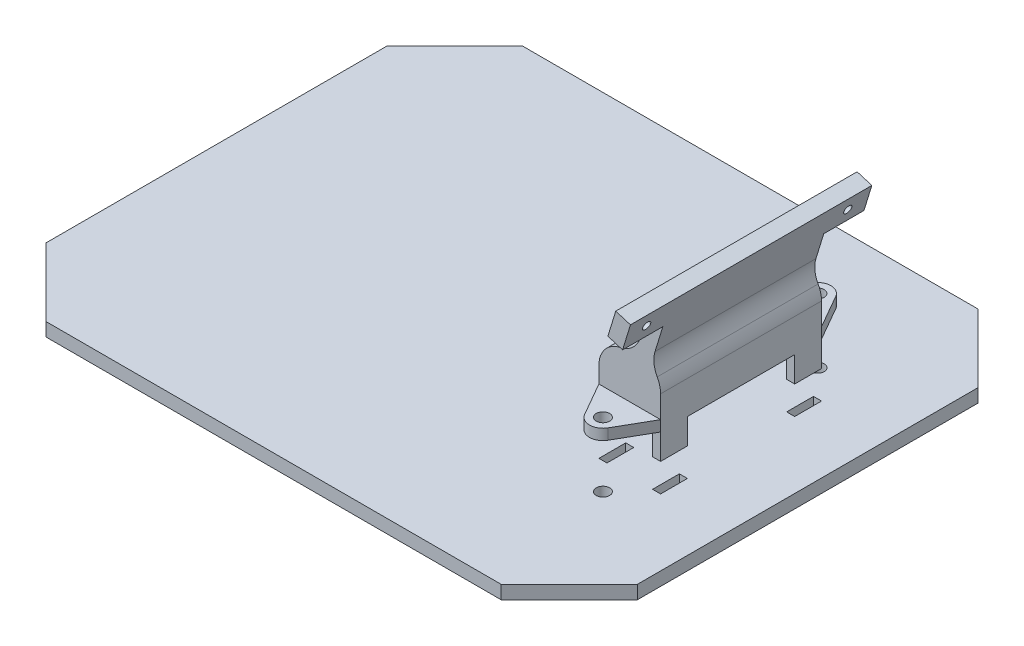
from build123d import *

# Parameters (mm, degrees)
SKETCH2_W               = 190.5
SKETCH2_H               = 177.8
BOSS_EXTRUDE1_DEPTH     = 5.08
CHAMFER1_SIZE           = 25.4
BOSS_EXTRUDE3_DEPTH     = 68.42
SKETCH5_R               = 9
SKETCH5_R_2             = 1.5
CUT_EXTRUDE1_DEPTH      = 231.530019737
SKETCH10_W              = 177.8
SKETCH10_H              = 73.5
BOSS_EXTRUDE6_DEPTH     = 30
CHAMFER3_SIZE           = 25.4
CUT_EXTRUDE2_DEPTH      = 68.42
BOSS_EXTRUDE7_START     = 38.1
BOSS_EXTRUDE7_DEPTH     = 10
SKETCH13_W              = 15.24
SKETCH13_H              = 10
BOSS_EXTRUDE8_DEPTH     = 7
SKETCH14_R              = 2.5
CUT_EXTRUDE3_DEPTH      = 10
MIRROR4_COPY_1_SKETCH_W = 15.24
MIRROR4_COPY_1_SKETCH_H = 10
MIRROR4_COPY_1_DEPTH    = 7
MIRROR4_COPY_2_SKETCH_R = 2.5
MIRROR4_COPY_2_DEPTH    = 10
BOSS_EXTRUDE9_START     = 5
BOSS_EXTRUDE9_DEPTH     = 5
BOSS_EXTRUDE10_START    = 10
BOSS_EXTRUDE10_DEPTH    = 5
SKETCH16_R              = 2.5
CUT_EXTRUDE4_DEPTH      = 163.946494286
SKETCH17_W              = 3
SKETCH17_H              = 10
CUT_EXTRUDE5_DEPTH      = 163.946494286
BOSS_EXTRUDE11_START    = 10
SKETCH18_W              = 3
SKETCH18_H              = 10
BOSS_EXTRUDE11_DEPTH    = 10
BOSS_EXTRUDE11_2_DEPTH  = 10
BOSS_EXTRUDE11_3_DEPTH  = 10
BOSS_EXTRUDE11_4_DEPTH  = 10
SKETCH19_W              = 23
SKETCH19_H              = 60
BOSS_EXTRUDE12_DEPTH    = 20
BOSS_EXTRUDE13_START    = -20
SKETCH20_R              = 2.5
BOSS_EXTRUDE13_DEPTH    = 4
BOSS_EXTRUDE16_DEPTH    = 60
FILLET1_R               = 10
SKETCH24_W              = 90
SKETCH24_H              = 10
BOSS_EXTRUDE17_DEPTH    = 5.736414059
SKETCH25_R              = 1.5
CUT_EXTRUDE7_DEPTH      = 10
FILLET2_R               = 10
FILLET3_R               = 10
FILLET4_R               = 10
CHAMFER4_SIZE           = 0.5


with BuildPart() as part:
    # Sketch2 → Boss-Extrude1 (new body)
    with BuildSketch(Plane(origin=(0, 0, 0), x_dir=(1, 0, 0), z_dir=(0, 1, 0))):
        with Locations((-31.75, -12.7)):
            Rectangle(SKETCH2_W, SKETCH2_H)
    extrude(amount=BOSS_EXTRUDE1_DEPTH)

    # Chamfer1
    chamfer1_edges = [part.edges().sort_by_distance(p)[0] for p in [
        (-127, 2.54, -76.2),
        (-127, 2.54, 101.6),
    ]]
    chamfer(chamfer1_edges, length=CHAMFER1_SIZE)

    # Sketch4 → Boss-Extrude3 (add)
    with BuildSketch(Plane(origin=(0, 5.08, 0), x_dir=(1, 0, 0), z_dir=(0, 1, 0))):
        Polygon((57.15, 69.85), (-98.969743879, 69.85), (-120.65, 48.169743879), (-120.65, -73.569743879), (-98.969743879, -95.25), (57.15, -95.25), (63.5, -95.25), (63.5, -101.6), (-101.6, -101.6), (-127, -76.2), (-127, 50.8), (-101.6, 76.2), (63.5, 76.2), (63.5, 69.85), align=None)
    extrude(amount=BOSS_EXTRUDE3_DEPTH)

    # Sketch5 → Cut-Extrude1 (cut, through all)
    with BuildSketch(Plane.XY.offset(101.6)):
        with Locations((-50.8, 31.75)):
            Circle(SKETCH5_R)
        with Locations((-50.8, 47.25)):
            Circle(SKETCH5_R_2)
        with Locations((-37.376606241, 39.5)):
            Circle(SKETCH5_R_2)
        with Locations((-37.376606241, 24)):
            Circle(SKETCH5_R_2)
        with Locations((-50.8, 16.25)):
            Circle(SKETCH5_R_2)
        with Locations((-64.223393759, 24)):
            Circle(SKETCH5_R_2)
        with Locations((-64.223393759, 39.5)):
            Circle(SKETCH5_R_2)
    extrude(amount=-CUT_EXTRUDE1_DEPTH, mode=Mode.SUBTRACT)

    # Sketch10 → Boss-Extrude6 (add)
    with BuildSketch(Plane(origin=(63.5, 0, 0), x_dir=(0, 0, -1), z_dir=(1, 0, 0))):
        with Locations((-12.7, 36.75)):
            Rectangle(SKETCH10_W, SKETCH10_H)
    extrude(amount=BOSS_EXTRUDE6_DEPTH)

    # Chamfer3
    chamfer3_edges = [part.edges().sort_by_distance(p)[0] for p in [
        (93.5, 36.75, 101.6),
        (93.5, 36.75, -76.2),
    ]]
    chamfer(chamfer3_edges, length=CHAMFER3_SIZE)

    # Sketch11 → Cut-Extrude2 (cut)
    with BuildSketch(Plane(origin=(0, 73.5, 0), x_dir=(1, 0, 0), z_dir=(0, 1, 0))):
        Polygon((85.757180746, -72.992819254), (85.757180746, 47.592819254), (63.5, 69.85), (63.5, -95.25), align=None)
    extrude(amount=-CUT_EXTRUDE2_DEPTH, mode=Mode.SUBTRACT)

    # Sketch12 → Boss-Extrude7 (add)
    with BuildSketch(Plane(origin=(0, 0, 95.25), x_dir=(-1, 0, 0), z_dir=(0, 0, -1)).offset(BOSS_EXTRUDE7_START)):
        with BuildLine():
            Line((25.8, 5.08), (75.8, 5.08))
            Line((75.8, 5.08), (75.8, 31.75))
            Line((75.8, 31.75), (69.8, 31.75))
            ThreePointArc((69.8, 31.75), (50.8, 12.75), (31.8, 31.75))
            Line((31.8, 31.75), (25.8, 31.75))
            Line((25.8, 31.75), (25.8, 5.08))
        make_face()
    boss_extrude7 = extrude(amount=BOSS_EXTRUDE7_DEPTH)

    # Sketch13 → Boss-Extrude8 (add)
    with BuildSketch(Plane(origin=(0, 31.75, 0), x_dir=(1, 0, 0), z_dir=(0, 1, 0))):
        with Locations((-24.18, -52.15)):
            Rectangle(SKETCH13_W, SKETCH13_H)
    boss_extrude8 = extrude(amount=-BOSS_EXTRUDE8_DEPTH)

    # Sketch14 → Cut-Extrude3 (cut)
    with BuildSketch(Plane(origin=(0, 31.75, 0), x_dir=(1, 0, 0), z_dir=(0, 1, 0))):
        with Locations(Location((-20.37, -52.15, 0), (0, 0, 270))):
            Circle(SKETCH14_R)
    cut_extrude3 = extrude(amount=-CUT_EXTRUDE3_DEPTH, mode=Mode.SUBTRACT)

    # Mirror2: Boss-Extrude8 across plane
    add(boss_extrude8.mirror(Plane.ZY.offset(50.8)))

    # Mirror3: Cut-Extrude3 across plane
    add(cut_extrude3.mirror(Plane.ZY.offset(50.8)), mode=Mode.SUBTRACT)

    # Mirror4: Boss-Extrude7, Boss-Extrude8, Cut-Extrude3 across plane
    add(boss_extrude7.mirror(Plane.XY.offset(12.7)))
    add(boss_extrude8.mirror(Plane.XY.offset(12.7)))
    add(cut_extrude3.mirror(Plane.XY.offset(12.7)), mode=Mode.SUBTRACT)

    # Mirror4 copy 1 sketch → Mirror4 copy 1 (add)
    with BuildSketch(Plane(origin=(-101.6, 31.75, 25.4), x_dir=(-1, 0, 0), z_dir=(0, 1, 0))):
        with Locations((-24.18, -52.15)):
            Rectangle(MIRROR4_COPY_1_SKETCH_W, MIRROR4_COPY_1_SKETCH_H)
    extrude(amount=-MIRROR4_COPY_1_DEPTH)

    # Mirror4 copy 2 sketch → Mirror4 copy 2 (cut)
    with BuildSketch(Plane(origin=(-101.6, 31.75, 25.4), x_dir=(-1, 0, 0), z_dir=(0, 1, 0))):
        with Locations(Location((-20.37, -52.15, 0), (0, 0, 270))):
            Circle(MIRROR4_COPY_2_SKETCH_R)
    extrude(amount=-MIRROR4_COPY_2_DEPTH, mode=Mode.SUBTRACT)


with BuildPart() as body_2:
    # Sketch15 → Boss-Extrude9 (new body)
    with BuildSketch(Plane(origin=(0, 73.5, 0), x_dir=(1, 0, 0), z_dir=(0, 1, 0)).offset(BOSS_EXTRUDE9_START)):
        Polygon((85.757180746, 47.592819254), (63.5, 69.85), (-98.969743879, 69.85), (-120.65, 48.169743879), (-120.65, -73.569743879), (-98.969743879, -95.25), (63.5, -95.25), (85.757180746, -72.992819254), align=None)
    extrude(amount=BOSS_EXTRUDE9_DEPTH)

    # Sketch15<3> → Boss-Extrude10 (add)
    with BuildSketch(Plane(origin=(0, 73.5, 0), x_dir=(1, 0, 0), z_dir=(0, 1, 0)).offset(BOSS_EXTRUDE10_START)):
        Polygon((93.5, -76.2), (93.5, 50.8), (68.1, 76.2), (-101.6, 76.2), (-127, 50.8), (-127, -76.2), (-101.6, -101.6), (68.1, -101.6), align=None)
    extrude(amount=BOSS_EXTRUDE10_DEPTH)

    # Sketch16 → Cut-Extrude4 (cut, through all)
    with BuildSketch(Plane(origin=(0, 88.5, 0), x_dir=(1, 0, 0), z_dir=(0, 1, 0))):
        with Locations(Location((57.153941403, 27.3, 0), (0, 0, 270))):
            Circle(SKETCH16_R)
        with Locations(Location((57.153941403, -52.7, 0), (0, 0, 270))):
            Circle(SKETCH16_R)
    extrude(amount=-CUT_EXTRUDE4_DEPTH, mode=Mode.SUBTRACT)

    # Sketch17 → Cut-Extrude5 (cut, through all)
    with BuildSketch(Plane(origin=(0, 88.5, 0), x_dir=(1, 0, 0), z_dir=(0, 1, 0))):
        with Locations((47.153941403, 12.3)):
            Rectangle(SKETCH17_W, SKETCH17_H)
        with Locations((67.153941403, 12.3)):
            Rectangle(SKETCH17_W, SKETCH17_H)
        with Locations((47.153941403, -37.7)):
            Rectangle(SKETCH17_W, SKETCH17_H)
        with Locations((67.153941403, -37.7)):
            Rectangle(SKETCH17_W, SKETCH17_H)
    extrude(amount=-CUT_EXTRUDE5_DEPTH, mode=Mode.SUBTRACT)


with BuildPart() as body_2_2:
    # Sketch18 → Boss-Extrude11 (new body)
    with BuildSketch(Plane(origin=(0, 88.5, 0), x_dir=(1, 0, 0), z_dir=(0, 1, 0)).offset(BOSS_EXTRUDE11_START)):
        with Locations((67.153941403, -37.7)):
            Rectangle(SKETCH18_W, SKETCH18_H)
    extrude(amount=BOSS_EXTRUDE11_DEPTH)



with BuildPart() as body_3:
    # Sketch18 → Boss-Extrude11 2 (new body)
    with BuildSketch(Plane(origin=(0, 88.5, 0), x_dir=(1, 0, 0), z_dir=(0, 1, 0)).offset(BOSS_EXTRUDE11_START)):
        with Locations((47.153941403, -37.7)):
            Rectangle(SKETCH18_W, SKETCH18_H)
    extrude(amount=BOSS_EXTRUDE11_2_DEPTH)


with BuildPart() as body_4:
    # Sketch18 → Boss-Extrude11 3 (new body)
    with BuildSketch(Plane(origin=(0, 88.5, 0), x_dir=(1, 0, 0), z_dir=(0, 1, 0)).offset(BOSS_EXTRUDE11_START)):
        with Locations((47.153941403, 12.3)):
            Rectangle(SKETCH18_W, SKETCH18_H)
    extrude(amount=BOSS_EXTRUDE11_3_DEPTH)


with BuildPart() as body_5:
    # Sketch18 → Boss-Extrude11 4 (new body)
    with BuildSketch(Plane(origin=(0, 88.5, 0), x_dir=(1, 0, 0), z_dir=(0, 1, 0)).offset(BOSS_EXTRUDE11_START)):
        with Locations((67.153941403, 12.3)):
            Rectangle(SKETCH18_W, SKETCH18_H)
    extrude(amount=BOSS_EXTRUDE11_4_DEPTH)


with BuildPart() as body_2_2_1:
    add(body_2_2.part)

    add(body_3.part)  # Boss-Extrude12 merges body 3

    add(body_4.part)  # Boss-Extrude12 merges body 4

    add(body_5.part)  # Boss-Extrude12 merges body 5
    # Sketch19 → Boss-Extrude12 (add)
    with BuildSketch(Plane(origin=(0, 108.5, 0), x_dir=(1, 0, 0), z_dir=(0, 1, 0))):
        with Locations((57.153941403, -12.7)):
            Rectangle(SKETCH19_W, SKETCH19_H)
    extrude(amount=BOSS_EXTRUDE12_DEPTH)

    # Sketch20 → Boss-Extrude13 (add)
    # profile 1 of 2: a face of its own
    with BuildSketch(Plane(origin=(0, 128.5, 0), x_dir=(1, 0, 0), z_dir=(0, 1, 0)).offset(BOSS_EXTRUDE13_START)):
        with BuildLine():
            Line((45.653941403, 17.3), (52.816765935, 29.787751788))
            ThreePointArc((52.816765935, 29.787751788), (57.153941403, 32.3), (61.491116871, 29.787751788))
            Line((61.491116871, 29.787751788), (68.653941403, 17.3))
            Line((68.653941403, 17.3), (45.653941403, 17.3))
        make_face()
        with Locations(Location((57.153941403, 27.3, 0), (0, 0, 270))):
            Circle(SKETCH20_R, mode=Mode.SUBTRACT)
    # profile 2 of 2: a face of its own
    with BuildSketch(Plane(origin=(0, 128.5, 0), x_dir=(1, 0, 0), z_dir=(0, 1, 0)).offset(BOSS_EXTRUDE13_START)):
        with BuildLine():
            Line((68.653941403, -42.7), (61.491116871, -55.187751788))
            ThreePointArc((61.491116871, -55.187751788), (57.153941403, -57.7), (52.816765935, -55.187751788))
            Line((52.816765935, -55.187751788), (45.653941403, -42.7))
            Line((45.653941403, -42.7), (68.653941403, -42.7))
        make_face()
        with Locations(Location((57.153941403, -52.7, 0), (0, 0, 90))):
            Circle(SKETCH20_R, mode=Mode.SUBTRACT)
    extrude(amount=BOSS_EXTRUDE13_DEPTH)

    # Sketch23 → Boss-Extrude16 (add)
    with BuildSketch(Plane.XY.offset(42.7)):
        Polygon((60.153941403, 112.5), (72.418398612, 152.5), (66.418398612, 152.5), (54.153941403, 112.5), align=None)
    extrude(amount=-BOSS_EXTRUDE16_DEPTH)

    # Fillet1
    # the kernel refuses this fillet: 10 mm, written as the material it takes off along each edge
    with BuildSketch(Plane(origin=(68.653941403, 128.5, 61.897321696), x_dir=(-1, 0, 0), z_dir=(0, 0, -1))) as fillet1_piece_1:
        with BuildLine():
            CenterArc((10, -7.678928678), FILLET1_R, 129.834954534, 50.165045466)
            Line((0, -7.678928678), (-0.2, -7.678928678))
            Line((-0.2, -7.678928678), (-0.2, 0))
            Line((-0.2, 0), (0, 0.2))
            ThreePointArc((0, 0.2), (1.797108558, 0.2), (3.466101459, 0.153578574))
            Line((3.466101459, 0.153578574), (3.594217116, 0))
        make_face()
    extrude(amount=98.394643391, mode=Mode.SUBTRACT)

    # Sketch24 → Boss-Extrude17 (add)
    with BuildSketch(Plane(origin=(23.455125777, -7.191609661, 0), x_dir=(0, 0, -1), z_dir=(0.9560690098650367, -0.2931416865198267, 0))):
        with Locations((-12.7, 162.029375509)):
            Rectangle(SKETCH24_W, SKETCH24_H)
    extrude(amount=-BOSS_EXTRUDE17_DEPTH)

    # Sketch25 → Cut-Extrude7 (cut)
    with BuildSketch(Plane(origin=(23.455125777, -7.191609661, 0), x_dir=(0, 0, -1), z_dir=(0.9560690098650367, -0.2931416865198267, 0))):
        with Locations(Location((-50.2, 162.029375509, 0), (0, 0, 90))):
            Circle(SKETCH25_R)
        with Locations(Location((24.8, 162.029375509, 0), (0, 0, 270))):
            Circle(SKETCH25_R)
    extrude(amount=-CUT_EXTRUDE7_DEPTH, mode=Mode.SUBTRACT)

    # Fillet2
    fillet2_edges = [body_2_2_1.edges().sort_by_distance(p)[0] for p in [
        (45.653941403, 128.5, 12.7),
    ]]
    fillet(fillet2_edges, radius=FILLET2_R)

    # Fillet3
    fillet3_edges = [body_2_2_1.edges().sort_by_distance(p)[0] for p in [
        (65.059724287, 128.5, 12.7),
    ]]
    fillet(fillet3_edges, radius=FILLET3_R)

    # Fillet4
    fillet4_edges = [body_2_2_1.edges().sort_by_distance(p)[0] for p in [
        (59.059724287, 128.5, 12.7),
    ]]
    fillet(fillet4_edges, radius=FILLET4_R)

    # Chamfer4
    chamfer4_edges = [body_2_2_1.edges().sort_by_distance(p)[0] for p in [
        (67.153941403, 98.5, 42.7),
        (68.653941403, 98.5, -12.3),
        (67.153941403, 98.5, -7.3),
        (65.653941403, 98.5, -12.3),
        (67.153941403, 98.5, -17.3),
        (65.653941403, 98.5, 37.7),
        (67.153941403, 98.5, 32.7),
        (48.653941403, 98.5, 37.7),
        (47.153941403, 98.5, 42.7),
        (45.653941403, 98.5, 37.7),
        (47.153941403, 98.5, 32.7),
        (68.653941403, 98.5, 37.7),
        (47.153941403, 98.5, -7.3),
        (48.653941403, 98.5, -12.3),
        (47.153941403, 98.5, -17.3),
        (45.653941403, 98.5, -12.3),
    ]]
    chamfer(chamfer4_edges, length=CHAMFER4_SIZE)


solid = Compound([body_2.part, body_2_2_1.part])
